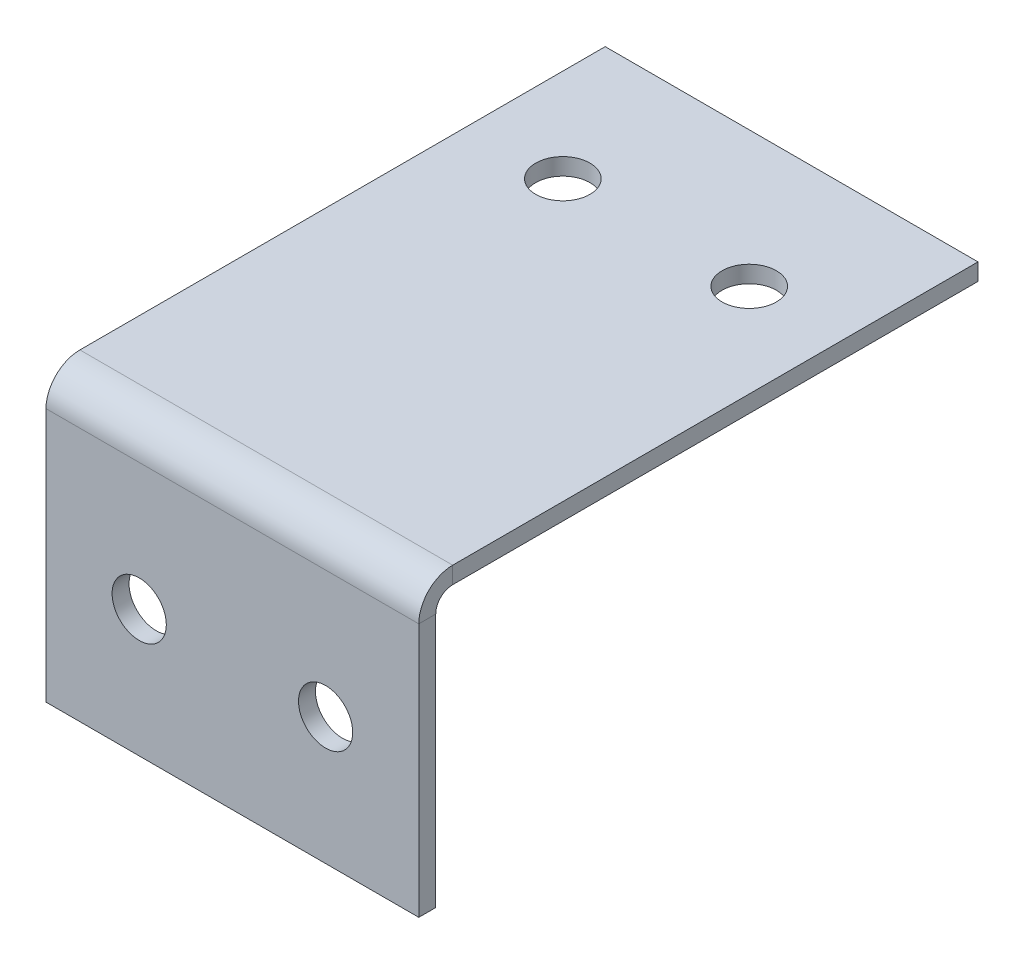
from build123d import *

# Parameters (mm, degrees)
BASE_FLANGE1_DEPTH = 17.4625
SKETCH6_R          = 2.54
CUT_EXTRUDE1_DEPTH = 2.54
SKETCH7_R          = 2.54
CUT_EXTRUDE2_DEPTH = 2.54


# Sheet-metal steps are written as plain solids
with BuildPart() as part:
    # Sketch1 → Base-Flange1 (new, symmetric)
    with BuildSketch(Plane(origin=(0, 0, 0), x_dir=(0, 0, -1), z_dir=(1, 0, 0))):
        with BuildLine():
            Line((0, 0), (0, 23.8125))
            ThreePointArc((0, 23.8125), (0.464967985, 24.935032015), (1.5875, 25.4))
            Line((1.5875, 25.4), (50.8, 25.4))
            Line((50.8, 25.4), (50.8, 26.9875))
            Line((50.8, 26.9875), (1.5875, 26.9875))
            ThreePointArc((1.5875, 26.9875), (-0.65756403, 26.05756403), (-1.5875, 23.8125))
            Line((-1.5875, 23.8125), (-1.5875, 0))
            Line((-1.5875, 0), (0, 0))
        make_face()
    extrude(amount=BASE_FLANGE1_DEPTH, both=True)

    # Sketch6 → Cut-Extrude1 (cut)
    with BuildSketch(Plane.XY.offset(1.5875)):
        with Locations((-8.73125, 11.90625)):
            Circle(SKETCH6_R)
        with Locations((8.73125, 11.90625)):
            Circle(SKETCH6_R)
    extrude(amount=-CUT_EXTRUDE1_DEPTH, mode=Mode.SUBTRACT)

    # Sketch7 → Cut-Extrude2 (cut)
    with BuildSketch(Plane(origin=(0, 26.9875, 0), x_dir=(1, 0, 0), z_dir=(0, 1, 0))):
        with Locations(Location((-8.73125, 38.1, 0), (0, 0, 270))):
            Circle(SKETCH7_R)
        with Locations(Location((8.73125, 38.1, 0), (0, 0, 270))):
            Circle(SKETCH7_R)
    extrude(amount=-CUT_EXTRUDE2_DEPTH, mode=Mode.SUBTRACT)


solid = part.part
